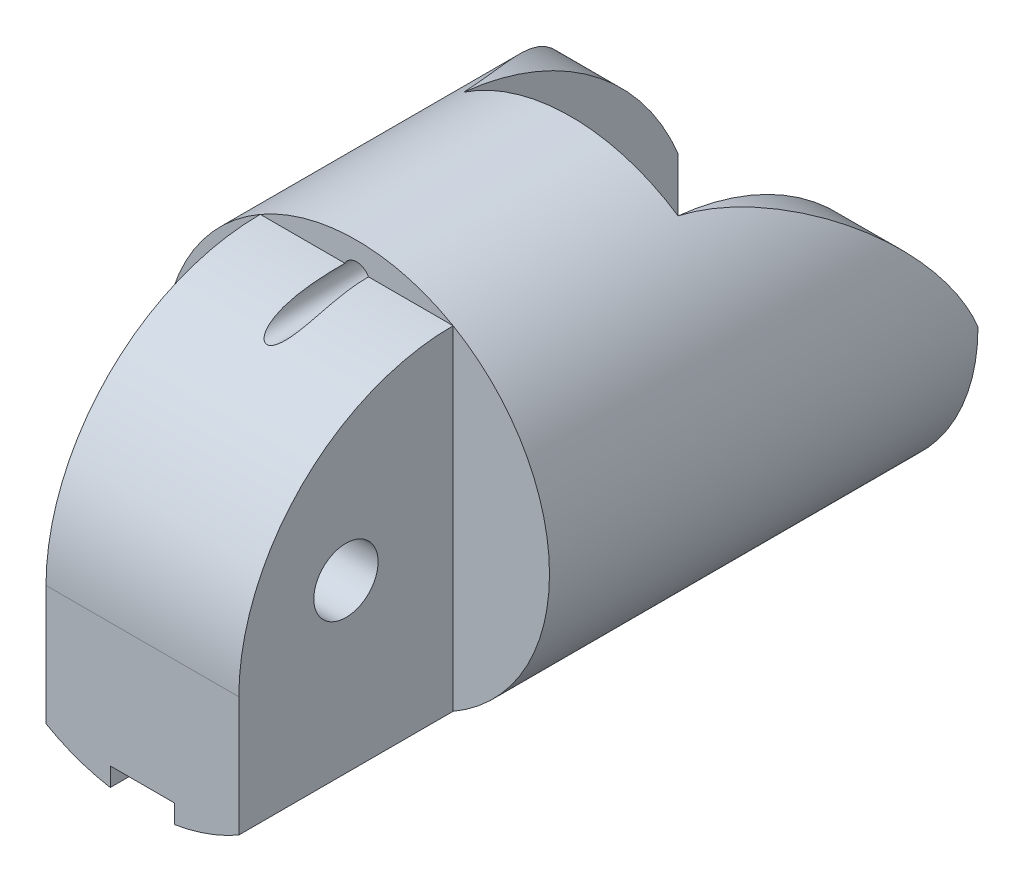
from build123d import *

# Parameters (mm, degrees)
SKETCH1_R               = 9
BOSS_EXTRUDE1_DEPTH     = 20
CUT_EXTRUDE1_DEPTH      = 24.706539182
CUT_EXTRUDE1_DEPTH_BACK = 24.706539182
SKETCH2_W               = 10
SKETCH2_H               = 10
BOSS_EXTRUDE2_START     = 10
BOSS_EXTRUDE2_DEPTH     = 10
CUT_EXTRUDE2_DEPTH      = 8
CUT_EXTRUDE2_DEPTH_BACK = 24.706539182
SKETCH4_R               = 1.5
FILLET1_R               = 10
CUT_EXTRUDE3_DEPTH      = 24.706539343
CUT_EXTRUDE3_DEPTH_BACK = 24.706539343
SKETCH6_R               = 0.625
CUT_EXTRUDE4_DEPTH      = 32
CUT_EXTRUDE5_REACH      = 25.707
SKETCH7_W               = 3
SKETCH7_H               = 2
SKETCH8_R               = 0.9
CUT_EXTRUDE6_DEPTH      = 5


with BuildPart() as part:
    # Sketch1 → Boss-Extrude1 (new body)
    with BuildSketch(Plane.XY):
        Circle(SKETCH1_R)
    extrude(amount=-BOSS_EXTRUDE1_DEPTH)

    # Sketch2 → Cut-Extrude1 (cut, two sides: drawn at the far end of the back side and taken through both)
    with BuildSketch(Plane(origin=(0, 0, 0), x_dir=(1, 0, 0), z_dir=(0, 1, 0)).offset(-CUT_EXTRUDE1_DEPTH_BACK)):
        with Locations((0, 15)):
            Rectangle(SKETCH2_W, SKETCH2_H)
    extrude(amount=CUT_EXTRUDE1_DEPTH + CUT_EXTRUDE1_DEPTH_BACK, mode=Mode.SUBTRACT)

    # Sketch3 → Boss-Extrude2 (add)
    with BuildSketch(Plane.XY.offset(BOSS_EXTRUDE2_START)):
        with BuildLine():
            Line((-4.5, 7.794228634), (-4.5, -7.794228634))
            ThreePointArc((-4.5, -7.794228634), (0, -9), (4.5, -7.794228634))
            Line((4.5, -7.794228634), (4.5, 7.794228634))
            Line((4.5, 7.794228634), (-4.5, 7.794228634))
        make_face()
    extrude(amount=-BOSS_EXTRUDE2_DEPTH)

    # Sketch4 → Cut-Extrude2 (cut, two sides: drawn at the far end of the back side and taken through both)
    with BuildSketch(Plane(origin=(0, 0, 0), x_dir=(0, 0, -1), z_dir=(1, 0, 0)).offset(-CUT_EXTRUDE2_DEPTH_BACK)):
        with Locations((-5, 0)):
            Circle(SKETCH4_R)
        with Locations((16, 0)):
            Circle(SKETCH4_R)
    extrude(amount=CUT_EXTRUDE2_DEPTH + CUT_EXTRUDE2_DEPTH_BACK, mode=Mode.SUBTRACT)

    # Fillet1
    fillet1_edges = [part.edges().sort_by_distance(p)[0] for p in [
        (0, 7.794228634, 10),
    ]]
    fillet(fillet1_edges, radius=FILLET1_R - 0.0001)  # a hair under: the kernel refuses the full size

    # Sketch5 → Cut-Extrude3 (cut, two sides: drawn at the far end of the back side and taken through both)
    with BuildSketch(Plane(origin=(0, 0, 0), x_dir=(0, 0, -1), z_dir=(1, 0, 0)).offset(-CUT_EXTRUDE3_DEPTH_BACK)):
        with BuildLine():
            Line((10, 7.483314774), (20, 7.483314774))
            Line((20, 7.483314774), (20, 0))
            ThreePointArc((20, 0), (16.031389946, 5.119910176), (10, 7.483314774))
        make_face()
    extrude(amount=CUT_EXTRUDE3_DEPTH + CUT_EXTRUDE3_DEPTH_BACK, mode=Mode.SUBTRACT)

    # Sketch6 → Cut-Extrude4 (cut)
    with BuildSketch(Plane(origin=(0, 0, -20), x_dir=(-1, 0, 0), z_dir=(0, 0, -1))):
        with Locations(Location((0, 7.5, 0), (0, 0, 28.084018699))):
            Circle(SKETCH6_R)
    extrude(amount=-CUT_EXTRUDE4_DEPTH, mode=Mode.SUBTRACT)

    # Sketch7 → Cut-Extrude5 (cut, up to next)
    with BuildSketch(Plane(origin=(0, 0, -10), x_dir=(-1, 0, 0), z_dir=(0, 0, -1)), mode=Mode.PRIVATE) as cut_extrude5_sk1:
        with Locations((0, -9)):
            Rectangle(SKETCH7_W, SKETCH7_H)
    cut_extrude5_tool1 = extrude(cut_extrude5_sk1.sketch, amount=-CUT_EXTRUDE5_REACH, mode=Mode.PRIVATE) & part.part
    add(cut_extrude5_tool1.solids().sort_by_distance((0, -9, -10))[0], mode=Mode.SUBTRACT)

    # Sketch8 → Cut-Extrude6 (cut)
    with BuildSketch(Plane(origin=(0, -8, 0), x_dir=(-1, 0, 0), z_dir=(0, -1, 0))):
        with Locations(Location((0, 0, 0), (0, 0, 90))):
            Circle(SKETCH8_R)
    extrude(amount=-CUT_EXTRUDE6_DEPTH, mode=Mode.SUBTRACT)


solid = part.part
